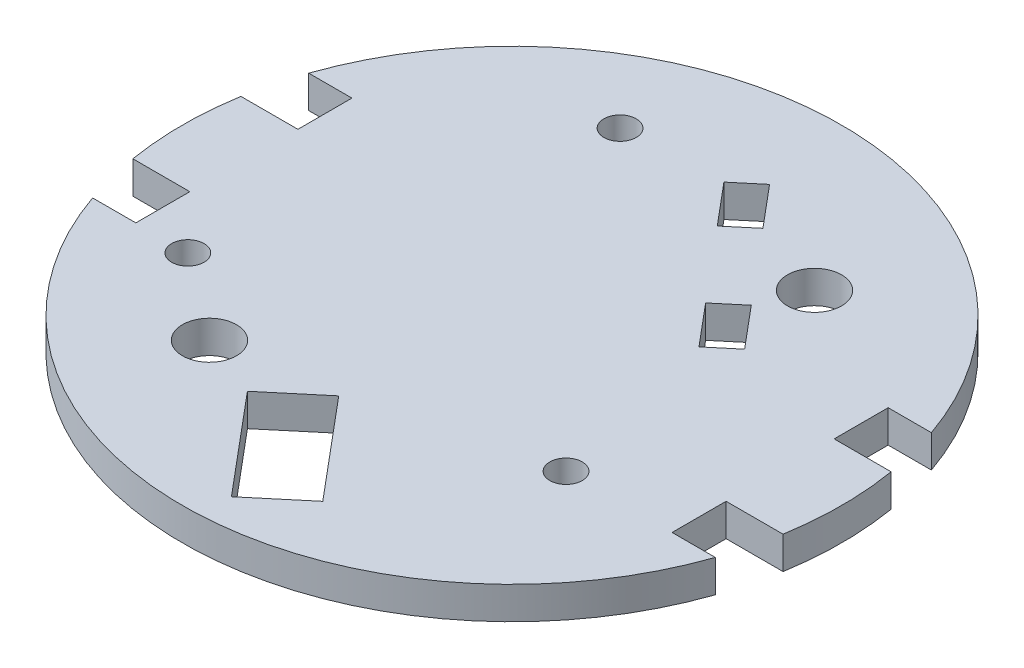
from build123d import *

# Parameters (mm, degrees)
CROQUIS1_R              = 30.5
SALIENTE_EXTRUIR1_DEPTH = 3
CORTAR_EXTRUIR3_START   = -4
CORTAR_EXTRUIR3_DEPTH   = 4
CORTAR_EXTRUIR5_DEPTH   = 4
CROQUIS8_R              = 2.5
CORTAR_EXTRUIR6_DEPTH   = 10
CROQUIS9_R              = 1.5
CORTAR_EXTRUIR7_DEPTH   = 3


with BuildPart() as part:
    # Croquis1 → Saliente-Extruir1 (new body)
    with BuildSketch(Plane(origin=(0, 0, 0), x_dir=(1, 0, 0), z_dir=(0, 1, 0))):
        Circle(CROQUIS1_R)
    extrude(amount=SALIENTE_EXTRUIR1_DEPTH)

    # Croquis5 → Cortar-Extruir3 (cut)
    with BuildSketch(Plane(origin=(0, 3, 0), x_dir=(1, 0, 0), z_dir=(0, 1, 0)).offset(CORTAR_EXTRUIR3_START)):
        with BuildLine():
            Line((30.087372767, -5), (24.814059068, -5))
            Line((24.814059068, -5), (24.814059068, -10))
            Line((24.814059068, -10), (28.814059068, -10))
            ThreePointArc((28.814059068, -10), (29.556634924, -7.526973624), (30.087372767, -5))
        make_face()
        with BuildLine():
            Line((24.814059068, 5), (30.087372767, 5))
            ThreePointArc((30.087372767, 5), (29.556634924, 7.526973624), (28.814059068, 10))
            Line((28.814059068, 10), (24.814059068, 10))
            Line((24.814059068, 10), (24.814059068, 5))
        make_face()
        with BuildLine():
            ThreePointArc((-30.087372767, -5), (-29.556634924, -7.526973624), (-28.814059068, -10))
            Line((-28.814059068, -10), (-24.814059068, -10))
            Line((-24.814059068, -10), (-24.814059068, -5))
            Line((-24.814059068, -5), (-30.087372767, -5))
        make_face()
        with BuildLine():
            Line((-24.814059068, 10), (-28.814059068, 10))
            ThreePointArc((-28.814059068, 10), (-29.556634924, 7.526973624), (-30.087372767, 5))
            Line((-30.087372767, 5), (-24.814059068, 5))
            Line((-24.814059068, 5), (-24.814059068, 10))
        make_face()
    extrude(amount=CORTAR_EXTRUIR3_DEPTH, mode=Mode.SUBTRACT)

    # Croquis7 → Cortar-Extruir5 (cut)
    with BuildSketch(Plane(origin=(0, 3, 0), x_dir=(1, 0, 0), z_dir=(0, 1, 0))):
        Polygon((1.428390211, 22.411430151), (-0.869743118, 20.483067322), (2.34419493, 16.652845106), (4.642328259, 18.581207935), align=None)
        Polygon((10.266719844, 11.878319058), (7.968586515, 9.949956229), (11.182524563, 6.119734013), (13.480657893, 8.048096842), align=None)
    extrude(amount=-CORTAR_EXTRUIR5_DEPTH, mode=Mode.SUBTRACT)

    # Croquis8 → Cortar-Extruir6 (cut)
    with BuildSketch(Plane(origin=(0, 3, 0), x_dir=(1, 0, 0), z_dir=(0, 1, 0))):
        with Locations((12, 16)):
            Circle(CROQUIS8_R)
        with Locations((-12, -16)):
            Circle(CROQUIS8_R)
        Polygon((-1.558592329, -14.475370512), (-6.154858987, -18.33209617), (1.558592329, -27.524629488), (6.154858987, -23.66790383), align=None)
    extrude(amount=-CORTAR_EXTRUIR6_DEPTH, mode=Mode.SUBTRACT)

    # Croquis9 → Cortar-Extruir7 (cut)
    with BuildSketch(Plane(origin=(0, 3, 0), x_dir=(1, 0, 0), z_dir=(0, 1, 0))):
        with Locations((-10, 20)):
            Circle(CROQUIS9_R)
        with Locations((-20, -10)):
            Circle(CROQUIS9_R)
        with Locations((15, -10)):
            Circle(CROQUIS9_R)
    extrude(amount=-CORTAR_EXTRUIR7_DEPTH, mode=Mode.SUBTRACT)


solid = part.part
